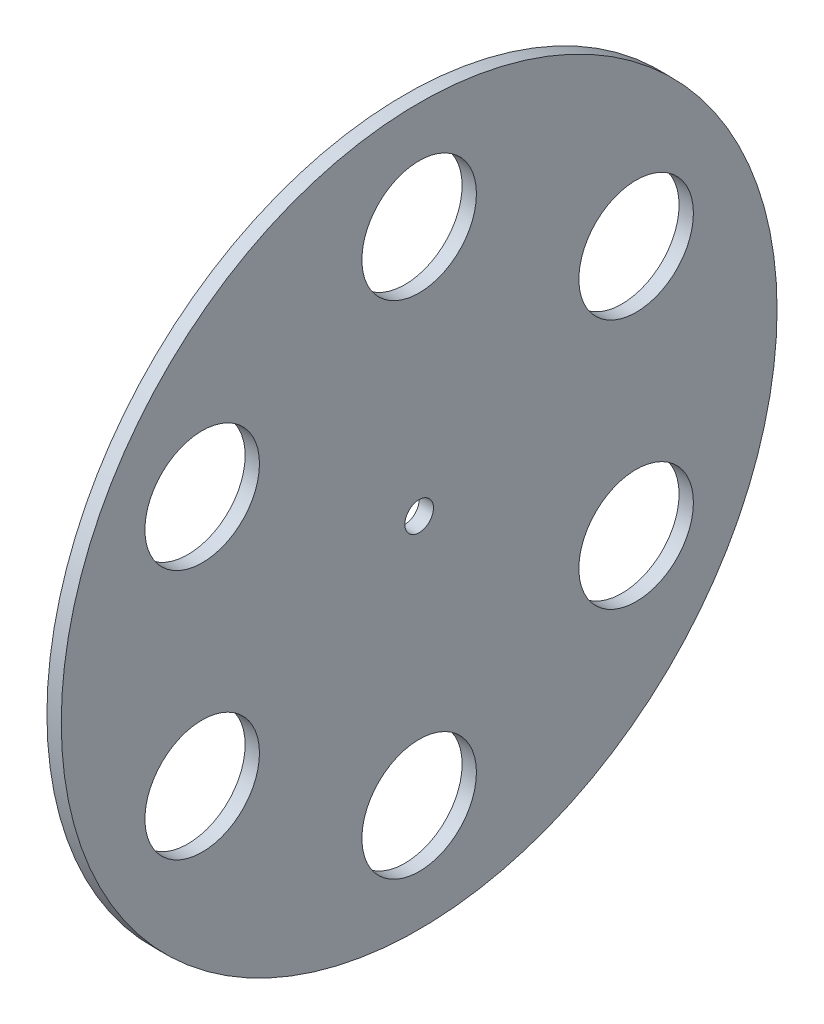
from build123d import *

# Parameters (mm, degrees)
SKETCH1_R           = 250
SKETCH1_R_2         = 10
SKETCH1_R_3         = 40
BOSS_EXTRUDE1_DEPTH = 10


with BuildPart() as part:
    # Sketch1 → Boss-Extrude1 (new body)
    with BuildSketch(Plane(origin=(0, 0, 0), x_dir=(0, 0, -1), z_dir=(1, 0, 0))):
        Circle(SKETCH1_R)
        Circle(SKETCH1_R_2, mode=Mode.SUBTRACT)
        with Locations((0, 175)):
            Circle(SKETCH1_R_3, mode=Mode.SUBTRACT)
        with Locations((151.554445662, 87.5)):
            Circle(SKETCH1_R_3, mode=Mode.SUBTRACT)
        with Locations((151.554445662, -87.5)):
            Circle(SKETCH1_R_3, mode=Mode.SUBTRACT)
        with Locations((0, -175)):
            Circle(SKETCH1_R_3, mode=Mode.SUBTRACT)
        with Locations((-151.554445662, -87.5)):
            Circle(SKETCH1_R_3, mode=Mode.SUBTRACT)
        with Locations((-151.554445662, 87.5)):
            Circle(SKETCH1_R_3, mode=Mode.SUBTRACT)
    extrude(amount=BOSS_EXTRUDE1_DEPTH)


solid = part.part
